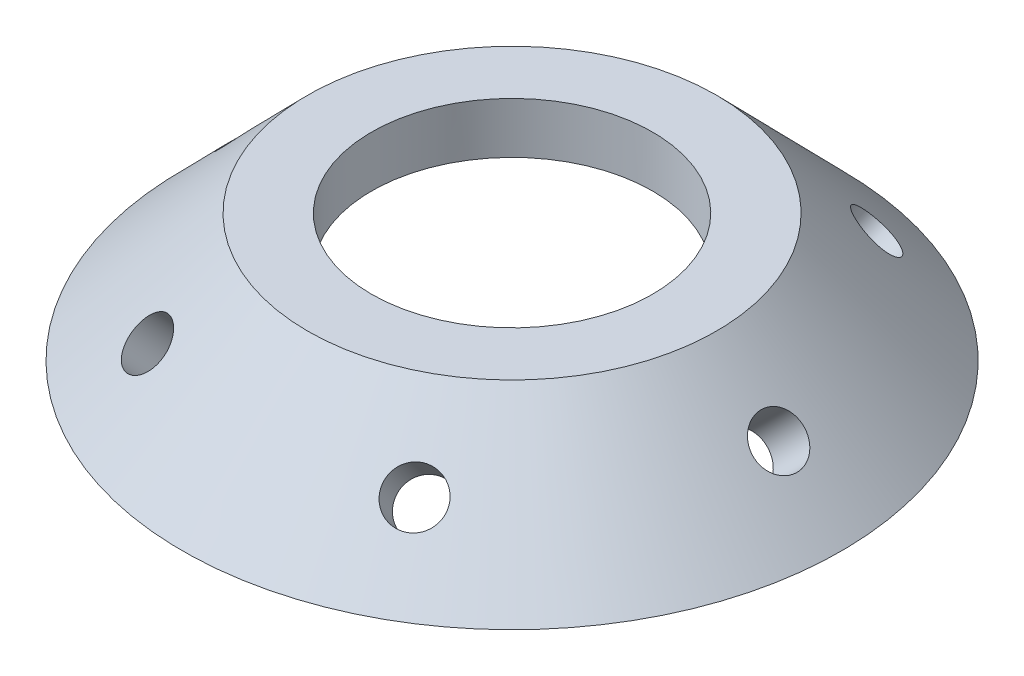
from build123d import *

# Parameters (mm, degrees)
SKETCH11_R         = 13.75
CUT_EXTRUDE1_DEPTH = 48.286846978
SKETCH24_R         = 2.5
CUT_EXTRUDE2_DEPTH = 58.86351753
CIRPATTERN10_COUNT = 6


with BuildPart() as part:
    # Sketch6 → Revolve2 (revolve)
    with BuildSketch(Plane.XY):
        Polygon((32.247448714, -12.5), (20, 0), (0, 0), (0, -5), (17.898979486, -5), (25.247448714, -12.5), align=None)
    revolve(axis=Axis((0, -5, 0), (0, 1, 0)))

    # Sketch11 → Cut-Extrude1 (cut, through all)
    with BuildSketch(Plane(origin=(0, 0, 0), x_dir=(1, 0, 0), z_dir=(0, 1, 0))):
        Circle(SKETCH11_R)
    extrude(amount=-CUT_EXTRUDE1_DEPTH, mode=Mode.SUBTRACT)

    # Sketch24 → Cut-Extrude2 (cut, through all)
    with BuildSketch(Plane(origin=(10.204081633, 9.997917317, 0), x_dir=(0, 0, -1), z_dir=(0.714285714285714, 0.6998542122237655, 0))):
        with Locations((0, -22.747084244)):
            Circle(SKETCH24_R)
    cut_extrude2 = extrude(amount=-CUT_EXTRUDE2_DEPTH, mode=Mode.SUBTRACT)

    # CirPattern10: Cut-Extrude2 ×6 about axis
    cirpattern10_axis = Axis((0, -5, 0), (0, -1, 0))
    for i in range(1, CIRPATTERN10_COUNT):
        add(cut_extrude2.rotate(cirpattern10_axis, i * 360 / CIRPATTERN10_COUNT), mode=Mode.SUBTRACT)


solid = part.part
